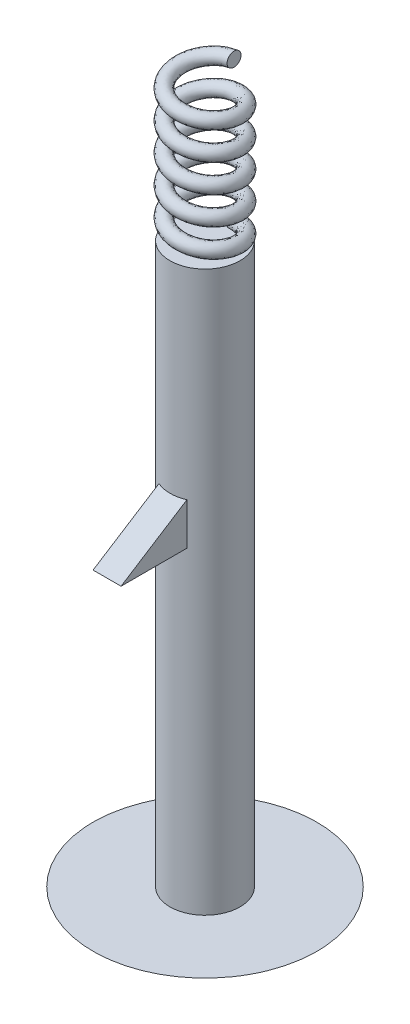
from build123d import *

# Parameters (mm, degrees)
EXTRUDE1_DEPTH      = 20
EXTRUDE1_DEPTH_BACK = 20
SKETCH1_R           = 2.5
SWEEP1_PITCH        = 2
SKETCH12_W          = 2
SKETCH12_H          = 3
EXTRUDE3_DEPTH      = 7
CUT_EXTRUDE2_DEPTH  = 32.678664408


with BuildPart() as part:
    # Sketch1 → Extrude1 (new, two sides: drawn at the far end of the back side and taken through both)
    with BuildSketch(Plane(origin=(0, 0, 0), x_dir=(1, 0, 0), z_dir=(0, 1, 0)).offset(-EXTRUDE1_DEPTH_BACK)):
        with Locations(Location((0, 0, 0), (0, 0, 270))):
            Circle(SKETCH1_R)
    extrude(amount=EXTRUDE1_DEPTH + EXTRUDE1_DEPTH_BACK)

    # Sweep1: arcs per turn and ends read off the stored shape
    # Sweep1: the profile of Sketch10 screwed along a left-hand helix through 5 turns, 6 arcs to a turn; built about Z, then put on its axis
    sweep1_z = Axis((0, 0, 0), (0, 0, 1))
    sweep1_corners = [(2.577211863, 0, 0.187804208), (2.077211863, 0, 0.687804208), (1.577211863, 0, 0.187804208), (2.077211863, 0, -0.312195792)]
    with BuildLine(mode=Mode.PRIVATE) as sweep1_profile:
        ThreePointArc((2.577211863, 0, 0.187804208), (2.430765254, 0, 0.541357598), (2.077211863, 0, 0.687804208))
        ThreePointArc((2.077211863, 0, 0.687804208), (1.723658472, 0, 0.541357598), (1.577211863, 0, 0.187804208))
        ThreePointArc((1.577211863, 0, 0.187804208), (1.723658472, 0, -0.165749183), (2.077211863, 0, -0.312195792))
        ThreePointArc((2.077211863, 0, -0.312195792), (2.430765254, 0, -0.165749183), (2.577211863, 0, 0.187804208))
    sweep1_cap = Face(sweep1_profile.wire())
    sweep1_arcs = [((2.577211863, 0, 0.187804208), (2.577211863, 0, 0.687804208), (2.077211863, 0, 0.687804208), (1, 0.7071067811865476, 1)), ((2.077211863, 0, 0.687804208), (1.577211863, 0, 0.687804208), (1.577211863, 0, 0.187804208), (1, 0.7071067811865476, 1)), ((1.577211863, 0, 0.187804208), (1.577211863, 0, -0.312195792), (2.077211863, 0, -0.312195792), (1, 0.7071067811865476, 1)), ((2.077211863, 0, -0.312195792), (2.577211863, 0, -0.312195792), (2.577211863, 0, 0.187804208), (1, 0.7071067811865476, 1))]  # start, shoulder, end, weights
    sweep1_turn_angles = [0, -30, -60, -90, -120, -150, -180, -210, -240, -270, -300, -330, -360]
    sweep1_turn_weights = [1, 0.8660254037844387, 1, 0.8660254037844387, 1, 0.8660254037844387, 1, 0.8660254037844387, 1, 0.8660254037844387, 1, 0.8660254037844387, 1]
    sweep1_turn_sides = [Face.make_bezier_surface([[Vector(p[j][0], p[j][1], 0).rotate(sweep1_z, sweep1_turn_angles[2 * i + k]) / sweep1_turn_weights[2 * i + k] + Vector(0, 0, p[j][2] + -SWEEP1_PITCH * sweep1_turn_angles[2 * i + k] / 360) for k in range(3)] for j in range(3)], [[p[3][j] * sweep1_turn_weights[2 * i + k] for k in range(3)] for j in range(3)]) for p in sweep1_arcs for i in range(6)]
    sweep1 = Plane(origin=(0, 20, 0), x_dir=(0, 0, -1), z_dir=(0, 1, 0)) * Solid(Shell([*[p.moved(Location((0, 0, SWEEP1_PITCH * i))) for i in range(5) for p in sweep1_turn_sides], sweep1_cap, sweep1_cap.rotate(sweep1_z, -1800).moved(Location((0, 0, -SWEEP1_PITCH * -1800 / 360)))]))
    add(sweep1)

    # Sketch12 → Extrude3 (add)
    with BuildSketch(Plane.XY):
        with Locations((0, 4.101629468)):
            Rectangle(SKETCH12_W, SKETCH12_H)
    extrude(amount=EXTRUDE3_DEPTH)

    # Sketch14 → Cut-Extrude2 (cut, through all)
    with BuildSketch(Plane(origin=(1, 0, 0), x_dir=(0, 0, -1), z_dir=(1, 0, 0))):
        Polygon((-7, 2.601629468), (-2.291287847, 5.601629468), (-7, 5.601629468), align=None)
    extrude(amount=-CUT_EXTRUDE2_DEPTH, mode=Mode.SUBTRACT)

    # Loft1: read off the stored shape, not the designer's step
    # Loft1: loft between two sections, ruled curve by curve
    loft1_from = [
        Edge.make_bspline([(7.720424749, -20, 2.096435475), (3.527553799, -20, 17.537284972), (-11.913295698, -20, 13.344414022), (-7.720424749, -20, -2.096435475), (-3.527553799, -20, -17.537284972), (11.913295698, -20, -13.344414022), (7.720424749, -20, 2.096435475)], [0, 0, 0, 0, 0.5, 0.5, 0.5, 1, 1, 1, 1], 3, [1, 0.333333333, 0.333333333, 1, 0.333333333, 0.333333333, 1]),
    ]
    loft1_to = [
        Edge.make_bspline([(0.475236172, -22, -0.155404572), (0.786045316, -22, 0.795067772), (-0.164427028, -22, 1.105876916), (-0.475236172, -22, 0.155404572), (-0.786045316, -22, -0.795067772), (0.164427028, -22, -1.105876916), (0.475236172, -22, -0.155404572)], [0, 0, 0, 0, 0.5, 0.5, 0.5, 1, 1, 1, 1], 3, [1, 0.333333333, 0.333333333, 1, 0.333333333, 0.333333333, 1]),
    ]
    loft1 = Solid(Shell([*[Face.make_surface_from_curves(loft1_from[k], loft1_to[k]) for k in range(1)], Face(Wire(loft1_from)), Face(Wire(loft1_to))]))
    add(loft1)


solid = part.part
